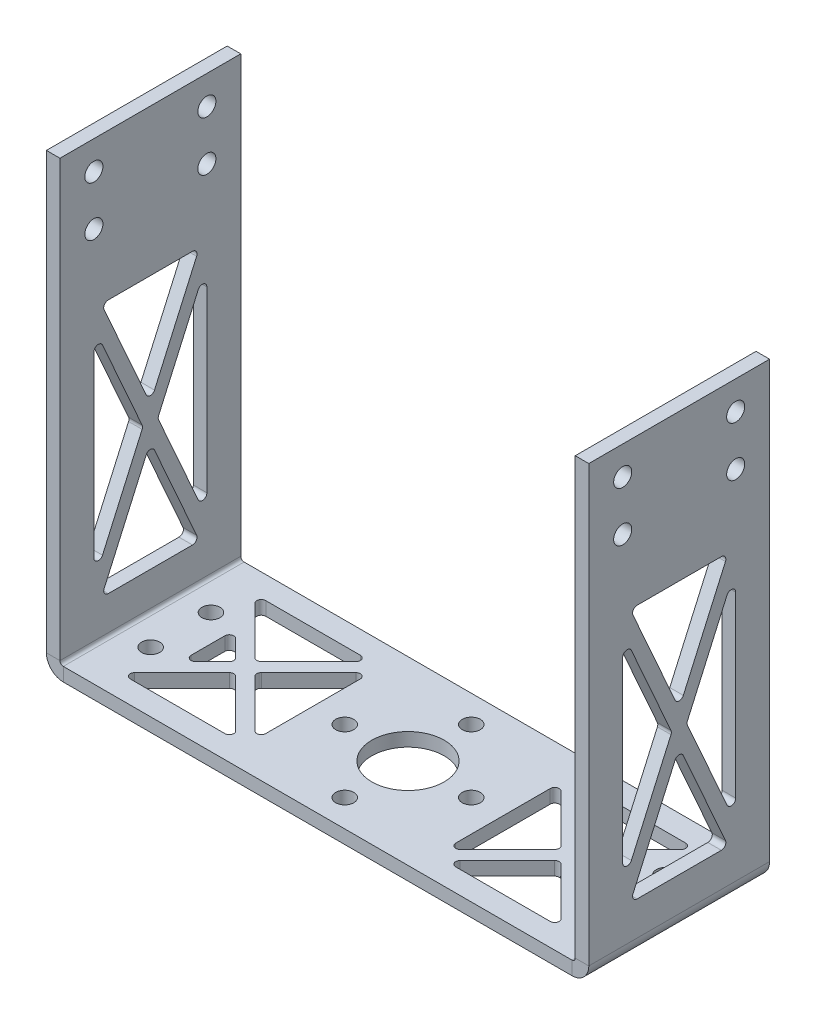
from build123d import *

# Parameters (mm, degrees)
SKETCH3_W                    = 114
SKETCH3_H                    = 40
BASE_FLANGE1_DEPTH           = 3
EDGE_FLANGE1_STRIP_W         = 13.4732
EDGE_FLANGE1_STRIP_H         = 3
EDGE_FLANGE1_STRIP_CUT_DEPTH = 40
EDGE_FLANGE1_DEPTH           = 40
EDGE_FLANGE2_STRIP_W         = 13.4732
EDGE_FLANGE2_STRIP_H         = 3
EDGE_FLANGE2_STRIP_CUT_DEPTH = 40
EDGE_FLANGE2_DEPTH           = 40
SKETCH11_R                   = 8
SKETCH11_R_2                 = 2
CUT_EXTRUDE1_DEPTH           = 10
CUT_EXTRUDE2_REACH           = 157.592
SKETCH12_R                   = 2
CUT_EXTRUDE3_DEPTH           = 156.592416268
CUT_EXTRUDE3_DEPTH_BACK      = 156.592416268
CUT_EXTRUDE4_DEPTH           = 10
FILLET1_R                    = 1


# Sheet-metal steps are written as plain solids
with BuildPart() as part:
    # Sketch3 → Base-Flange1 (new body)
    with BuildSketch(Plane(origin=(0, 0, 0), x_dir=(1, 0, 0), z_dir=(0, 1, 0))):
        Rectangle(SKETCH3_W, SKETCH3_H)
    extrude(amount=-BASE_FLANGE1_DEPTH)

    # Edge-Flange1 strip (across the edge) → Edge-Flange1 strip cut (cut)
    with BuildSketch(Plane(origin=(-57, 0, -20), x_dir=(1, 0, 0), z_dir=(0, 0, 1))):
        with Locations((-6, -1.5)):
            Rectangle(EDGE_FLANGE1_STRIP_W, EDGE_FLANGE1_STRIP_H)
    extrude(amount=EDGE_FLANGE1_STRIP_CUT_DEPTH, mode=Mode.SUBTRACT)

    # Edge-Flange1 section (across the edge) → Edge-Flange1 (add)
    with BuildSketch(Plane(origin=(-57, 0, -20), x_dir=(1, 0, 0), z_dir=(0, 0, 1))):
        with BuildLine():
            Line((-3, 0.7366), (-3, 97))
            Line((-3, 97), (0, 97))
            Line((0, 97), (0, 0.7366))
            ThreePointArc((0, 0.7366), (0.215745145, 0.215745145), (0.7366, 0))
            Line((0.7366, 0), (0.7366, -3))
            ThreePointArc((0.7366, -3), (-1.905575199, -1.905575199), (-3, 0.7366))
        make_face()
    extrude(amount=EDGE_FLANGE1_DEPTH)

    # Edge-Flange2 strip (across the edge) → Edge-Flange2 strip cut (cut)
    with BuildSketch(Plane(origin=(57, 0, 20), x_dir=(-1, 0, 0), z_dir=(0, 0, -1))):
        with Locations((-6, -1.5)):
            Rectangle(EDGE_FLANGE2_STRIP_W, EDGE_FLANGE2_STRIP_H)
    extrude(amount=EDGE_FLANGE2_STRIP_CUT_DEPTH, mode=Mode.SUBTRACT)

    # Edge-Flange2 section (across the edge) → Edge-Flange2 (add)
    with BuildSketch(Plane(origin=(57, 0, 20), x_dir=(-1, 0, 0), z_dir=(0, 0, -1))):
        with BuildLine():
            Line((-3, 0.7366), (-3, 97))
            Line((-3, 97), (0, 97))
            Line((0, 97), (0, 0.7366))
            ThreePointArc((0, 0.7366), (0.215745145, 0.215745145), (0.7366, 0))
            Line((0.7366, 0), (0.7366, -3))
            ThreePointArc((0.7366, -3), (-1.905575199, -1.905575199), (-3, 0.7366))
        make_face()
    extrude(amount=EDGE_FLANGE2_DEPTH)

    # Sketch11 → Cut-Extrude1 (cut)
    with BuildSketch(Plane(origin=(0, -3, 0), x_dir=(-1, 0, 0), z_dir=(0, -1, 0))):
        with Locations(Location((0, 0, 0), (0, 0, 90))):
            Circle(SKETCH11_R)
        with Locations(Location((0, 14, 0), (0, 0, 90))):
            Circle(SKETCH11_R_2)
        with Locations(Location((14, 0, 0), (0, 0, 90))):
            Circle(SKETCH11_R_2)
        with Locations(Location((0, -14, 0), (0, 0, 90))):
            Circle(SKETCH11_R_2)
        with Locations(Location((-14, 0, 0), (0, 0, 90))):
            Circle(SKETCH11_R_2)
        with Locations(Location((50.2634, 6.666666667, 0), (0, 0, 90))):
            Circle(SKETCH11_R_2)
        with Locations(Location((-50.2634, 6.666666667, 0), (0, 0, 90))):
            Circle(SKETCH11_R_2)
        with Locations(Location((50.2634, -6.666666667, 0), (0, 0, 90))):
            Circle(SKETCH11_R_2)
        with Locations(Location((-50.2634, -6.666666667, 0), (0, 0, 90))):
            Circle(SKETCH11_R_2)
    extrude(amount=-CUT_EXTRUDE1_DEPTH, mode=Mode.SUBTRACT)

    # Cut-Extrude2: up to this face of the body (flat: up to its plane)
    cut_extrude2_end = Plane(part.part.faces().sort_by_distance((-60, 48.8683, 0))[0])
    # Sketch12 → Cut-Extrude2 (cut, up to the picked face)
    with BuildSketch(Plane(origin=(60, 0, 0), x_dir=(0, 0, -1), z_dir=(1, 0, 0)), mode=Mode.PRIVATE) as cut_extrude2_sk1:
        with Locations(Location((12.5, 79.674243403, 0), (0, 0, 90))):
            Circle(SKETCH12_R)
    cut_extrude2_tool1 = split(extrude(cut_extrude2_sk1.sketch, amount=-CUT_EXTRUDE2_REACH, mode=Mode.PRIVATE), bisect_by=cut_extrude2_end, keep=Keep.BOTH, mode=Mode.PRIVATE)
    # Sketch12 → Cut-Extrude2 (cut, up to the picked face)
    with BuildSketch(Plane(origin=(60, 0, 0), x_dir=(0, 0, -1), z_dir=(1, 0, 0)), mode=Mode.PRIVATE) as cut_extrude2_sk2:
        with Locations(Location((12.5, 90.674243403, 0), (0, 0, 90))):
            Circle(SKETCH12_R)
    cut_extrude2_tool2 = split(extrude(cut_extrude2_sk2.sketch, amount=-CUT_EXTRUDE2_REACH, mode=Mode.PRIVATE), bisect_by=cut_extrude2_end, keep=Keep.BOTH, mode=Mode.PRIVATE)
    # Sketch12 → Cut-Extrude2 (cut, up to the picked face)
    with BuildSketch(Plane(origin=(60, 0, 0), x_dir=(0, 0, -1), z_dir=(1, 0, 0)), mode=Mode.PRIVATE) as cut_extrude2_sk3:
        with Locations(Location((-12.5, 79.674243403, 0), (0, 0, 90))):
            Circle(SKETCH12_R)
    cut_extrude2_tool3 = split(extrude(cut_extrude2_sk3.sketch, amount=-CUT_EXTRUDE2_REACH, mode=Mode.PRIVATE), bisect_by=cut_extrude2_end, keep=Keep.BOTH, mode=Mode.PRIVATE)
    # Sketch12 → Cut-Extrude2 (cut, up to the picked face)
    with BuildSketch(Plane(origin=(60, 0, 0), x_dir=(0, 0, -1), z_dir=(1, 0, 0)), mode=Mode.PRIVATE) as cut_extrude2_sk4:
        with Locations(Location((-12.5, 90.674243403, 0), (0, 0, 90))):
            Circle(SKETCH12_R)
    cut_extrude2_tool4 = split(extrude(cut_extrude2_sk4.sketch, amount=-CUT_EXTRUDE2_REACH, mode=Mode.PRIVATE), bisect_by=cut_extrude2_end, keep=Keep.BOTH, mode=Mode.PRIVATE)
    add(cut_extrude2_tool1.solids().sort_by(Axis((60, 79.674243, -12.5), (-1, 0, 0)))[0], mode=Mode.SUBTRACT)
    add(cut_extrude2_tool2.solids().sort_by(Axis((60, 90.674243, -12.5), (-1, 0, 0)))[0], mode=Mode.SUBTRACT)
    add(cut_extrude2_tool3.solids().sort_by(Axis((60, 79.674243, 12.5), (-1, 0, 0)))[0], mode=Mode.SUBTRACT)
    add(cut_extrude2_tool4.solids().sort_by(Axis((60, 90.674243, 12.5), (-1, 0, 0)))[0], mode=Mode.SUBTRACT)

    # Sketch14 → Cut-Extrude3 (cut, two sides: drawn at the far end of the back side and taken through both)
    with BuildSketch(Plane(origin=(60, 0, 0), x_dir=(0, 0, -1), z_dir=(1, 0, 0)).offset(-CUT_EXTRUDE3_DEPTH_BACK)):
        Polygon((-12.5, 60.805943605), (-1.641411821, 36.3683), (-12.5, 11.930656395), align=None)
        Polygon((-10.858588179, 64.5), (0, 40.062356395), (10.858588179, 64.5), align=None)
        Polygon((12.5, 60.805943605), (1.641411821, 36.3683), (12.5, 11.930656395), align=None)
        Polygon((10.858588179, 8.2366), (0, 32.674243605), (-10.858588179, 8.2366), align=None)
    extrude(amount=CUT_EXTRUDE3_DEPTH + CUT_EXTRUDE3_DEPTH_BACK, mode=Mode.SUBTRACT)

    # Sketch15 → Cut-Extrude4 (cut)
    with BuildSketch(Plane.XZ.offset(3)):
        Polygon((21, 12.878679656), (33.878679656, 0), (21, -12.878679656), align=None)
        Polygon((23.121320344, 15), (36, 2.121320344), (48.878679656, 15), align=None)
        Polygon((44.2634, 6.142079656), (38.121320344, 0), (44.2634, -6.142079656), align=None)
        Polygon((48.878679656, -15), (36, -2.121320344), (23.121320344, -15), align=None)
        Polygon((-23.121320344, -15), (-48.878679656, -15), (-36, -2.121320344), align=None)
        Polygon((-44.2634, -6.142079656), (-44.2634, 6.142079656), (-38.121320344, 0), align=None)
        Polygon((-48.878679656, 15), (-23.121320344, 15), (-36, 2.121320344), align=None)
        Polygon((-21, -12.878679656), (-21, 12.878679656), (-33.878679656, 0), align=None)
    extrude(amount=-CUT_EXTRUDE4_DEPTH, mode=Mode.SUBTRACT)

    # Fillet1
    fillet1_edges = [part.edges().sort_by_distance(p)[0] for p in [
        (58.5, 60.805943605, -12.5),
        (-58.5, 60.805943605, -12.5),
        (58.5, 11.930656395, -12.5),
        (-58.5, 11.930656395, -12.5),
        (58.5, 36.3683, -1.641411821),
        (-58.5, 36.3683, -1.641411821),
        (58.5, 64.5, 10.858588179),
        (-58.5, 64.5, 10.858588179),
        (58.5, 64.5, -10.858588179),
        (-58.5, 64.5, -10.858588179),
        (58.5, 40.062356395, 0),
        (-58.5, 40.062356395, 0),
        (58.5, 8.2366, -10.858588179),
        (-58.5, 8.2366, -10.858588179),
        (58.5, 8.2366, 10.858588179),
        (-58.5, 8.2366, 10.858588179),
        (58.5, 32.674243605, 0),
        (-58.5, 32.674243605, 0),
        (58.5, 11.930656395, 12.5),
        (-58.5, 11.930656395, 12.5),
        (58.5, 60.805943605, 12.5),
        (-58.5, 60.805943605, 12.5),
        (58.5, 36.3683, 1.641411821),
        (-58.5, 36.3683, 1.641411821),
        (-36, -1.5, -2.121320344),
        (-23.121320344, -1.5, -15),
        (-48.878679656, -1.5, -15),
        (48.878679656, -1.5, -15),
        (23.121320344, -1.5, -15),
        (36, -1.5, -2.121320344),
        (23.121320344, -1.5, 15),
        (48.878679656, -1.5, 15),
        (36, -1.5, 2.121320344),
        (44.2634, -1.5, 6.142079656),
        (44.2634, -1.5, -6.142079656),
        (38.121320344, -1.5, 0),
        (-21, -1.5, -12.878679656),
        (-33.878679656, -1.5, 0),
        (-21, -1.5, 12.878679656),
        (-38.121320344, -1.5, 0),
        (-44.2634, -1.5, -6.142079656),
        (-44.2634, -1.5, 6.142079656),
        (-36, -1.5, 2.121320344),
        (-48.878679656, -1.5, 15),
        (-23.121320344, -1.5, 15),
        (21, -1.5, -12.878679656),
        (21, -1.5, 12.878679656),
        (33.878679656, -1.5, 0),
    ]]
    fillet(fillet1_edges, radius=FILLET1_R)


solid = part.part
